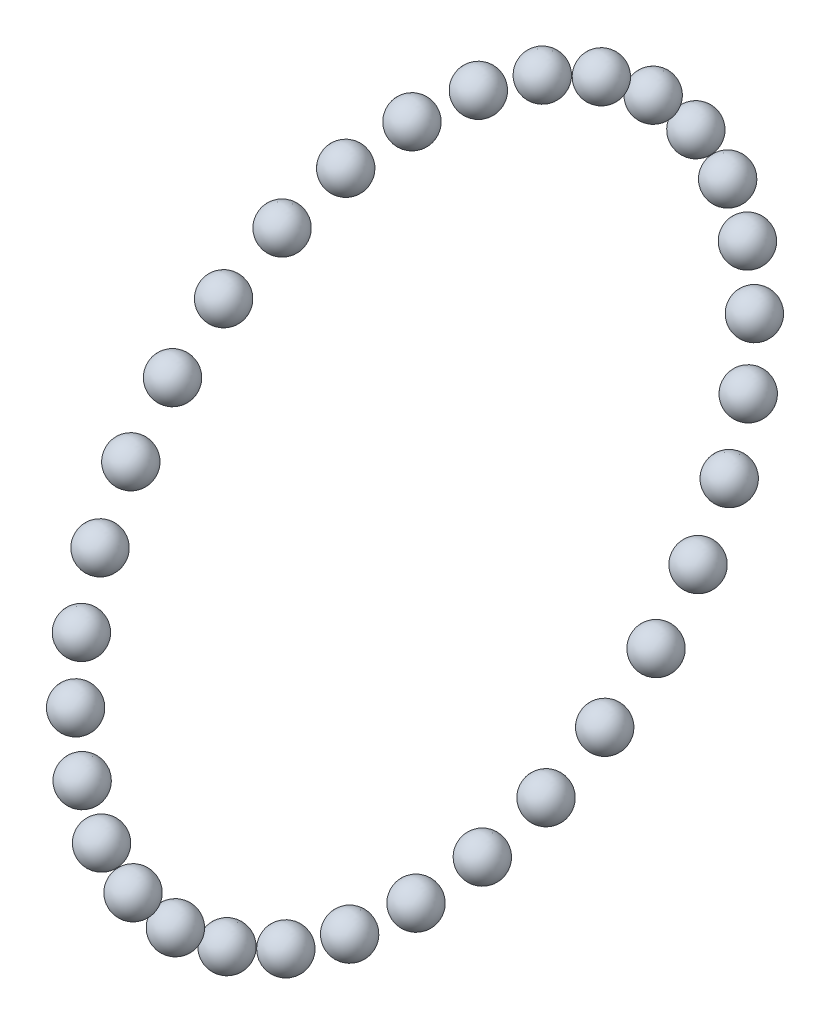
from build123d import *
from build123d.topology import SkipClean


with BuildPart() as part:
    # Sketch1 → Revolve1 (revolve)
    with SkipClean():  # the faces are left unmerged after this step: merging them gives an invalid solid
        with BuildSketch(Plane.XY):
            with BuildLine():
                ThreePointArc((6.5, 0), (0, 6.5), (-6.5, 0))
                Line((-6.5, 0), (6.5, 0))
            make_face()
            with BuildLine():
                Line((6.5, 0), (-6.5, 0))
                ThreePointArc((-6.5, 0), (0, -6.5), (6.5, 0))
            make_face()
        revolve(axis=Axis((-6.5, 0, 0), (1, 0, 0)))
    add(part.part.scale(1), mode=Mode.REPLACE)  # the faces are merged on a copy


with BuildPart() as body_2:
    # CrvPattern1: read off the stored shape, not the designer's step
    # CrvPattern1: copy of part
    add(part.part.moved(Location((0, 19.6178931, -1.8181137))))


with BuildPart() as body_3:
    # CrvPattern1 2: copy of part
    add(part.part.moved(Location((0, 39.7489717, -7.6763822))))


with BuildPart() as body_4:
    # CrvPattern1 3: copy of part
    add(part.part.moved(Location((0, 58.3467483, -17.3563791))))


with BuildPart() as body_5:
    # CrvPattern1 4: copy of part
    add(part.part.moved(Location((0, 74.6938205, -30.484702))))


with BuildPart() as body_6:
    # CrvPattern1 5: copy of part
    add(part.part.moved(Location((0, 88.1596061, -46.5549309))))


with BuildPart() as body_7:
    # CrvPattern1 6: copy of part
    add(part.part.moved(Location((0, 98.2246673, -64.9471623))))


with BuildPart() as body_8:
    # CrvPattern1 7: copy of part
    add(part.part.moved(Location((0, 104.500748, -84.9519229))))


with BuildPart() as body_9:
    # CrvPattern1 8: copy of part
    add(part.part.moved(Location((0, 106.7457508, -105.7975363))))


with BuildPart() as body_10:
    # CrvPattern1 9: copy of part
    add(part.part.moved(Location((0, 104.8730755, -126.6798906))))


with BuildPart() as body_11:
    # CrvPattern1 10: copy of part
    add(part.part.moved(Location((0, 98.9549598, -146.7934567))))


with BuildPart() as body_12:
    # CrvPattern1 11: copy of part
    add(part.part.moved(Location((0, 89.219693, -165.3623612))))


with BuildPart() as body_13:
    # CrvPattern1 12: copy of part
    add(part.part.moved(Location((0, 76.0428092, -181.6703154))))


with BuildPart() as body_14:
    # CrvPattern1 13: copy of part
    add(part.part.moved(Location((0, 59.9326021, -195.088246))))


with BuildPart() as body_15:
    # CrvPattern1 14: copy of part
    add(part.part.moved(Location((0, 41.5105168, -205.0985612))))


with BuildPart() as body_16:
    # CrvPattern1 15: copy of part
    add(part.part.moved(Location((0, 21.4871787, -211.3151168))))


with BuildPart() as body_17:
    # CrvPattern1 16: copy of part
    add(part.part.moved(Location((0, 0.6349805, -213.4981115))))


with BuildPart() as body_18:
    # CrvPattern1 17: copy of part
    add(part.part.moved(Location((0, -20.2417118, -211.5633369))))


with BuildPart() as body_19:
    # CrvPattern1 18: copy of part
    add(part.part.moved(Location((0, -40.3375876, -205.5854265))))


with BuildPart() as body_20:
    # CrvPattern1 19: copy of part
    add(part.part.moved(Location((0, -58.8774557, -195.7949758))))


with BuildPart() as body_21:
    # CrvPattern1 20: copy of part
    add(part.part.moved(Location((0, -75.1461476, -182.5696479))))


with BuildPart() as body_22:
    # CrvPattern1 21: copy of part
    add(part.part.moved(Location((0, -88.5161045, -166.4196049))))


with BuildPart() as body_23:
    # CrvPattern1 22: copy of part
    add(part.part.moved(Location((0, -98.4715852, -147.9678288))))


with BuildPart() as body_24:
    # CrvPattern1 23: copy of part
    add(part.part.moved(Location((0, -104.6285607, -127.9260902))))


with BuildPart() as body_25:
    # CrvPattern1 24: copy of part
    add(part.part.moved(Location((0, -106.7495279, -107.0674916))))


with BuildPart() as body_26:
    # CrvPattern1 25: copy of part
    add(part.part.moved(Location((0, -104.7526713, -86.196646))))


with BuildPart() as body_27:
    # CrvPattern1 26: copy of part
    add(part.part.moved(Location((0, -98.7150189, -66.1186384))))


with BuildPart() as body_28:
    # CrvPattern1 27: copy of part
    add(part.part.moved(Location((0, -88.8694709, -47.6079706))))


with BuildPart() as body_29:
    # CrvPattern1 28: copy of part
    add(part.part.moved(Location((0, -75.5958158, -31.3786849))))


with BuildPart() as body_30:
    # CrvPattern1 29: copy of part
    add(part.part.moved(Location((0, -59.4060799, -18.05682))))


with BuildPart() as body_31:
    # CrvPattern1 30: copy of part
    add(part.part.moved(Location((0, -40.9247762, -8.1562619))))


with BuildPart() as body_32:
    # CrvPattern1 31: copy of part
    add(part.part.moved(Location((0, -20.8648144, -2.058921))))


solid = Compound([part.part, body_2.part, body_3.part, body_4.part, body_5.part, body_6.part, body_7.part, body_8.part, body_9.part, body_10.part, body_11.part, body_12.part, body_13.part, body_14.part, body_15.part, body_16.part, body_17.part, body_18.part, body_19.part, body_20.part, body_21.part, body_22.part, body_23.part, body_24.part, body_25.part, body_26.part, body_27.part, body_28.part, body_29.part, body_30.part, body_31.part, body_32.part])
